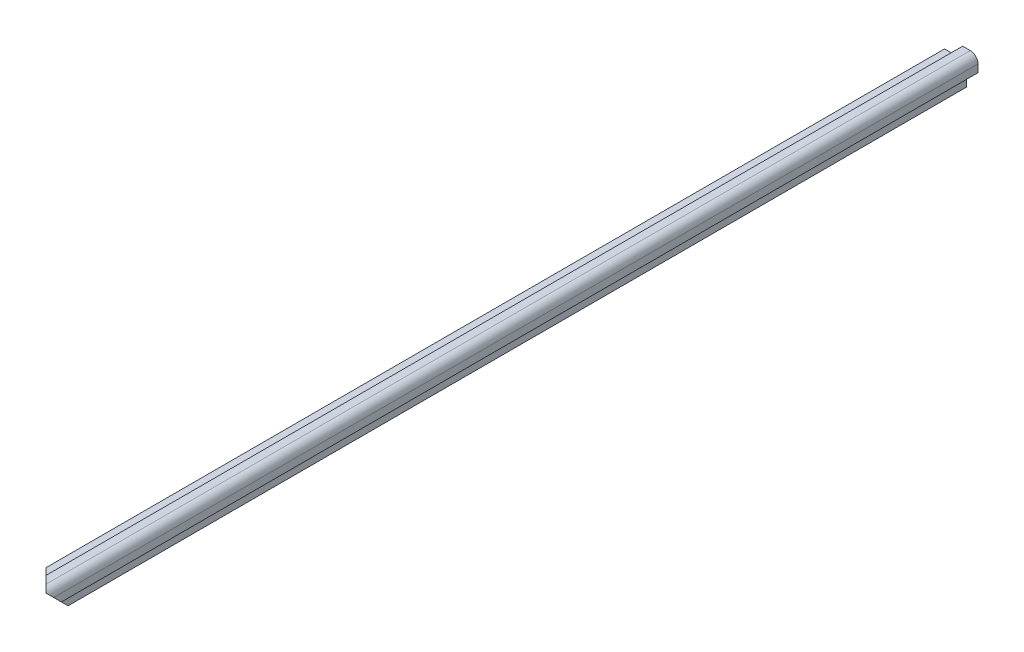
from build123d import *

# Parameters (mm, degrees)
SKETCH7_W               = 4.7625
SKETCH7_H               = 2.12122512
BOSS_EXTRUDE2_DEPTH     = 130.175
SKETCH8_W               = 2.12122512
SKETCH8_H               = 4.7625
BOSS_EXTRUDE3_DEPTH     = 130.175
BOSS_EXTRUDE4_DEPTH     = 130.175
CUT_EXTRUDE1_DEPTH      = 245.098438966
CUT_EXTRUDE1_DEPTH_BACK = 245.098438966


with BuildPart() as part:
    # Sketch7 → Boss-Extrude2 (new, symmetric)
    with BuildSketch(Plane.XY):
        with Locations((-4.92125, -2.560612608)):
            Rectangle(SKETCH7_W, SKETCH7_H)
    extrude(amount=BOSS_EXTRUDE2_DEPTH, both=True)

    # Sketch8 → Boss-Extrude3 (add, symmetric)
    with BuildSketch(Plane.XY):
        with Locations((-2.560612608, -4.92125)):
            Rectangle(SKETCH8_W, SKETCH8_H)
    extrude(amount=BOSS_EXTRUDE3_DEPTH, both=True)

    # Sketch11 → Boss-Extrude4 (add, symmetric)
    with BuildSketch(Plane.XY):
        with BuildLine():
            Line((-2.54, 1.500000048), (-2.54, -1.500000048))
            Line((-2.54, -1.500000048), (-7.3025, -1.500000048))
            Line((-7.3025, -1.500000048), (-7.3025, -3.621225168))
            Line((-7.3025, -3.621225168), (-5.866289198, -3.621225168))
            Line((-5.866289198, -3.621225168), (-3.621225168, -5.866289198))
            Line((-3.621225168, -5.866289198), (-3.621225168, -7.3025))
            Line((-3.621225168, -7.3025), (-1.500000048, -7.3025))
            Line((-1.500000048, -7.3025), (-1.500000048, -2.54))
            Line((-1.500000048, -2.54), (1.500000048, -2.54))
            Line((1.500000048, -2.54), (1.500000048, -0.519999976))
            ThreePointArc((1.500000048, -0.519999976), (0.908355739, 0.908355739), (-0.519999976, 1.500000048))
            Line((-0.519999976, 1.500000048), (-2.54, 1.500000048))
        make_face()
    extrude(amount=BOSS_EXTRUDE4_DEPTH, both=True)

    # Sketch17 → Cut-Extrude1 (cut, two sides: drawn at the far end of the back side and taken through both)
    with BuildSketch(Plane(origin=(0, 0, 113.704878), x_dir=(0.7071067811865479, -1.0569544952841983e-15, -0.7071067811865472), z_dir=(-0.5773502691896265, -0.5773502691896247, -0.5773502691896262)).offset(-CUT_EXTRUDE1_DEPTH_BACK)):
        Polygon((9.347296833, 5.396664343), (0, 0), (0, -10.793328686), (-219.970452561, 116.206671314), (-210.623155728, 132.396664343), align=None)
    extrude(amount=CUT_EXTRUDE1_DEPTH + CUT_EXTRUDE1_DEPTH_BACK, mode=Mode.SUBTRACT)


solid = part.part
